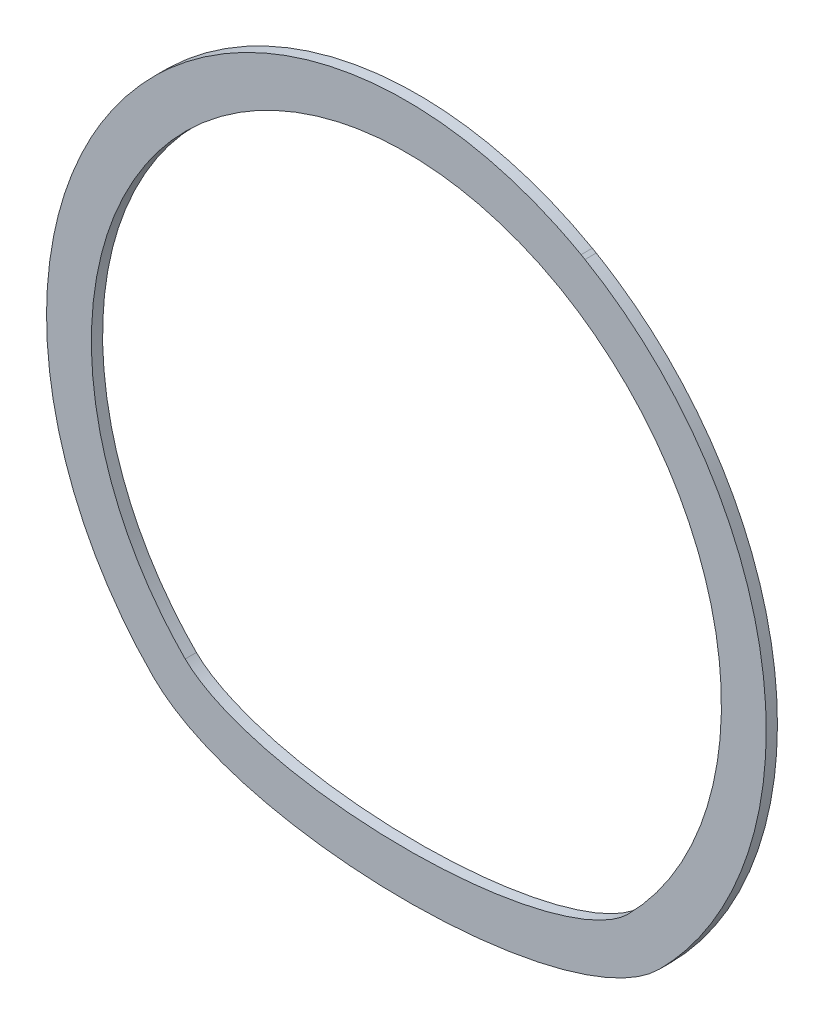
from build123d import *

# Parameters (mm, degrees)
BOSS_EXTRUDE1_DEPTH = 3.175


with BuildPart() as part:
    # Sketch2 → Boss-Extrude1 (new body)
    with BuildSketch(Plane.XY):
        with BuildLine():
            add(Edge.make_bspline(
                [(-71.677392112, -72.91043434), (-72.109242456, -72.4766599), (-72.972872043, -71.593614958), (-74.469591152, -70.002616718), (-75.837182996, -68.488043391), (-77.186084408, -66.931897067), (-78.515677479, -65.334729876), (-79.824432739, -63.69624614), (-81.54760822, -61.446428575), (-83.64161213, -58.529673548), (-85.629566809, -55.501403393), (-87.162218254, -52.997335562), (-88.285911427, -51.070131488), (-90.114728738, -47.772436811), (-92.549922179, -42.891387424), (-95.3516338, -36.175158441), (-97.806777615, -28.854790192), (-99.416568113, -22.492651102), (-100.484378106, -16.973479224), (-101.217383692, -12.115821661), (-101.805900705, -6.108471449), (-102.055561509, 1.055644647), (-101.63758347, 11.916616183), (-99.581715265, 24.703392789), (-94.947787628, 39.477591596), (-88.656512854, 52.708120751), (-80.043367163, 65.554146484), (-69.871244821, 76.755385293), (-58.636991603, 85.914826096), (-47.202028885, 92.898966836), (-35.790499648, 98.052224226), (-24.000842482, 101.716725174), (-12.029496563, 103.894248368), (-3.656941748, 104.395312689), (0.99110515, 104.372307848), (2.644688984, 104.347784008), (5.295920706, 104.255895368), (8.944129249, 104.002381094), (12.923536456, 103.566176285), (16.897932891, 102.969160213), (20.860675893, 102.210568115), (24.80503533, 101.28991654), (28.724197829, 100.207008268), (32.611281662, 98.961940132), (36.459348765, 97.555109249), (39.942943882, 96.118550993), (42.44327487, 94.981609399), (43.99462248, 94.237634049), (44.922549304, 93.78091779), (45.846607961, 93.314294304), (46.766722746, 92.837849145), (47.682656642, 92.351383169), (48.561810847, 91.873519084), (49.188310006, 91.524412896), (49.500915025, 91.348034768)],
                knots=[0, 0, 0, 0, 0.006795371, 0.013653749, 0.020575359, 0.027560428, 0.034609183, 0.041721853, 0.048898669, 0.063445664, 0.078252032, 0.085753069, 0.093319659, 0.100952039, 0.124124286, 0.148784986, 0.174947707, 0.20262677, 0.215493637, 0.232144402, 0.252599943, 0.276885796, 0.305032091, 0.363115877, 0.408011314, 0.462235121, 0.511576331, 0.564908162, 0.615597651, 0.658548959, 0.700915758, 0.742691235, 0.783870362, 0.824449909, 0.827808956, 0.831171349, 0.841278604, 0.854801757, 0.868378359, 0.882008332, 0.895691582, 0.909427999, 0.923217451, 0.937059793, 0.95095486, 0.964902468, 0.975397534, 0.978902417, 0.982410558, 0.985921952, 0.989436598, 0.99295449, 0.996475625, 1, 1, 1, 1], degree=3))
            add(Edge.make_bspline(
                [(49.500915025, 91.348034768), (49.872005924, 91.138482333), (50.241810712, 90.926750039), (50.610303013, 90.712853821)],
                knots=[0, 0, 0, 0, 1, 1, 1, 1], degree=3))
            add(Edge.make_bspline(
                [(50.610303013, 90.712853821), (51.128442093, 90.411846037), (52.167202685, 89.796039228), (53.932536969, 88.703576387), (55.579762788, 87.638711627), (57.218137155, 86.533145805), (58.847026669, 85.387425363), (60.465187486, 84.201108463), (62.61485058, 82.559008476), (65.268683437, 80.403244909), (68.38020159, 77.661045558), (71.420405526, 74.753669295), (74.379227375, 71.68115848), (77.246352549, 68.444125522), (79.542797672, 65.619898893), (81.324264236, 63.280297585), (82.635173495, 61.479754257), (83.915139631, 59.639466174), (85.682600666, 56.976700672), (87.896856718, 53.369477174), (90.462597049, 48.676901727), (92.889220315, 43.626105667), (95.132677705, 38.215723181), (97.146538959, 32.44823322), (98.88212407, 26.330630408), (100.289240179, 19.875099059), (101.25863273, 13.473856941), (101.817336128, 7.24671143), (102.015185645, 1.305015561), (101.87858065, -4.624237286), (101.39263307, -10.734726225), (100.537146292, -16.867570025), (99.329398352, -22.86381348), (97.893600846, -28.372193875), (96.656960211, -32.269847721), (95.785564151, -34.744415114), (95.0459628, -36.764317914), (93.953188789, -39.535816997), (92.43580554, -43.007047711), (90.821696456, -46.36490671), (89.118620831, -49.608230444), (87.334164726, -52.736260206), (85.475724639, -55.748623833), (83.55049497, -58.64531039), (81.56545684, -61.42664709), (79.307705413, -64.380683017), (77.436977348, -66.647222523), (76.007346494, -68.288860963), (75.29509586, -69.089727056), (74.579038656, -69.87823774), (73.859443089, -70.654502436), (73.136338858, -71.418398838), (72.317504882, -72.264736672), (71.891235125, -72.69667798), (71.678426975, -72.91043429)],
                knots=[0, 0, 0, 0, 0.010157109, 0.020393378, 0.030708694, 0.04110294, 0.051575992, 0.062127721, 0.072757993, 0.094253595, 0.116061609, 0.138180754, 0.160609666, 0.183346893, 0.206390897, 0.218027437, 0.229740057, 0.241528542, 0.253392669, 0.280162256, 0.30828042, 0.337739229, 0.368530108, 0.400643849, 0.434070605, 0.468799897, 0.504820602, 0.536144777, 0.567394405, 0.598569553, 0.629670285, 0.664058743, 0.696204476, 0.726123241, 0.753829745, 0.760691378, 0.767515904, 0.787767528, 0.807687634, 0.827278023, 0.846540474, 0.865476741, 0.88408856, 0.902377642, 0.920345676, 0.937994331, 0.961031903, 0.966703489, 0.972340071, 0.97794171, 0.983508463, 0.989040391, 0.99453755, 1, 1, 1, 1], degree=3))
            add(Edge.make_bspline(
                [(71.678426975, -72.91043429), (46.359928794, -98.341734638), (-46.358893881, -98.341734638), (-71.677392112, -72.91043434)],
                knots=[0, 0, 0, 0, 1, 1, 1, 1], degree=3, weights=[1, 1, 1, 1]))
        make_face()
        with BuildLine():
            add(Edge.make_bspline(
                [(-62.677197057, -63.950161522), (-62.895509204, -63.730876692), (-63.321725733, -63.298342375), (-64.002059554, -62.592101669), (-64.753829554, -61.794622516), (-65.703931611, -60.764569773), (-66.804574903, -59.527416198), (-68.556788175, -57.468052236), (-70.648178443, -54.835505477), (-73.811350461, -50.469012961), (-77.394544541, -44.756057433), (-82.302878117, -35.13540616), (-86.810757895, -22.360038108), (-90.354277409, -0.967371821), (-87.649941962, 26.350088977), (-73.333390238, 55.972118358), (-49.623996274, 78.708841275), (-24.487235723, 89.383519301), (-3.090994932, 92.115890306), (13.038963103, 91.197514401), (26.120286031, 87.996586306), (34.879374941, 84.524845656), (39.102105625, 82.510352052), (41.214271269, 81.410816796), (42.347028641, 80.797644792), (42.959233617, 80.456937494), (43.258169219, 80.288282027)],
                knots=[0, 0, 0, 0, 0.003906217, 0.007812434, 0.01171865, 0.015624867, 0.023437301, 0.031249734, 0.046874602, 0.062499469, 0.093749203, 0.124998938, 0.187498407, 0.249997875, 0.374996813, 0.499995751, 0.624994688, 0.749993626, 0.812493095, 0.874992564, 0.937492033, 0.968741767, 0.984366634, 0.992179068, 0.996085285, 0.999991501, 0.999991501, 0.999991501, 0.999991501], degree=3))
            add(Edge.make_bspline(
                [(43.258169219, 80.288282027), (43.339663738, 80.24226006), (43.502520945, 80.149972739), (43.746371392, 80.01083423), (43.989796594, 79.870982545), (44.151786326, 79.777278604), (44.232713854, 79.73030574)],
                knots=[0.002022438, 0.002022438, 0.002022438, 0.002022438, 0.251013535, 0.500004632, 0.748995729, 0.997986827, 0.997986827, 0.997986827, 0.997986827], degree=3))
            add(Edge.make_bspline(
                [(44.232713854, 79.73030574), (44.58444416, 79.525959484), (45.259622085, 79.127643656), (46.415361761, 78.422292298), (47.573803007, 77.692810893), (49.007921659, 76.758403592), (50.804832808, 75.530634538), (53.607223777, 73.493209173), (57.003409969, 70.790302329), (64.764138566, 63.842060668), (74.853642347, 51.769295456), (84.311822541, 33.000711524), (89.302574517, 12.581832114), (89.594071681, -8.463887057), (85.167338267, -29.022546245), (78.471156755, -43.288686452), (72.737789819, -52.004533398), (70.145497848, -55.492337454), (67.954788222, -58.18874646), (66.537169113, -59.834423786), (65.376799992, -61.124092609), (64.636118066, -61.923784826), (64.04885936, -62.544039678), (63.540759488, -63.072130947), (63.065749199, -63.559376825), (62.8132246, -63.814567336), (62.678231924, -63.950161468)],
                knots=[1.4601e-05, 1.4601e-05, 1.4601e-05, 1.4601e-05, 0.007826987, 0.015639373, 0.023451759, 0.031264145, 0.046888916, 0.062513688, 0.093763232, 0.125012776, 0.250010951, 0.375009125, 0.5000073, 0.625005475, 0.75000365, 0.875001825, 0.906251369, 0.937500913, 0.953125684, 0.968750456, 0.976562842, 0.984375228, 0.988281421, 0.992187614, 0.996093807, 1, 1, 1, 1], degree=3))
            add(Edge.make_bspline(
                [(62.678231924, -63.950161468), (62.442110433, -64.187331736), (61.973465348, -64.632177633), (60.848308103, -65.594894105), (59.178943877, -66.825880953), (56.737455869, -68.325151322), (52.942333804, -70.28884928), (47.260951473, -72.599488515), (39.221466424, -74.977986937), (30.229046438, -76.880115217), (17.304785319, -78.721740765), (0.000517457, -79.658688067), (-17.303750406, -78.721740765), (-30.228011525, -76.880115217), (-39.22043151, -74.977986937), (-47.25991656, -72.599488515), (-52.941298891, -70.28884928), (-56.736420955, -68.325151322), (-59.177908963, -66.825880953), (-60.84727319, -65.594894105), (-61.972430435, -64.632177633), (-62.441075519, -64.187331736), (-62.677197057, -63.950161522)],
                knots=[0, 0, 0, 0, 0.015625, 0.03125, 0.0625, 0.09375, 0.125, 0.1875, 0.25, 0.3125, 0.375, 0.5, 0.625, 0.6875, 0.75, 0.8125, 0.875, 0.90625, 0.9375, 0.96875, 0.984375, 1, 1, 1, 1], degree=3))
        make_face(mode=Mode.SUBTRACT)
    extrude(amount=-BOSS_EXTRUDE1_DEPTH)


solid = part.part
